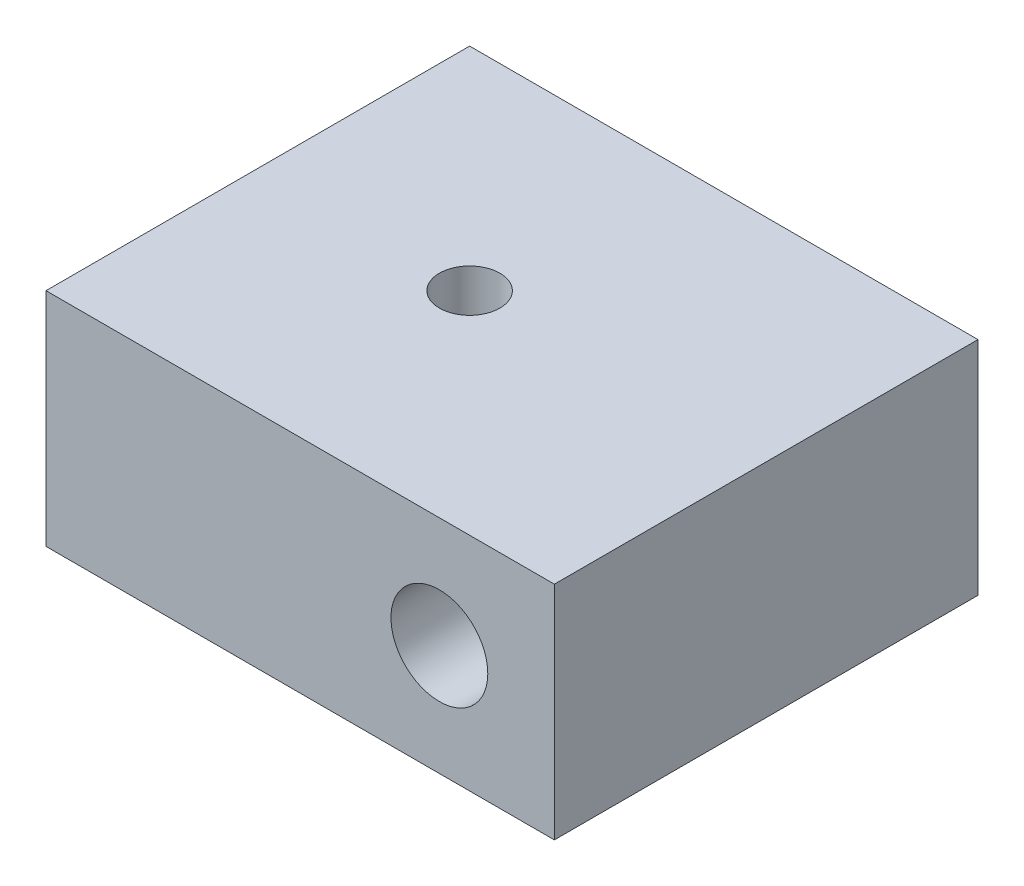
from build123d import *

# Parameters (mm, degrees)
SKETCH1_W           = 42
SKETCH1_H           = 35
SKETCH1_R           = 2.5
BOSS_EXTRUDE1_DEPTH = 18.3
SKETCH2_R           = 4
CUT_EXTRUDE1_DEPTH  = 58.653187249


with BuildPart() as part:
    # Sketch1 → Boss-Extrude1 (new body)
    with BuildSketch(Plane(origin=(0, 0, 0), x_dir=(1, 0, 0), z_dir=(0, 1, 0))):
        with Locations((21, 17.5)):
            Rectangle(SKETCH1_W, SKETCH1_H)
        with Locations((17.5, 17.5)):
            Circle(SKETCH1_R, mode=Mode.SUBTRACT)
    extrude(amount=BOSS_EXTRUDE1_DEPTH)

    # Sketch2 → Cut-Extrude1 (cut, through all)
    with BuildSketch(Plane.XY):
        with Locations((32.5, 9.15)):
            Circle(SKETCH2_R)
    extrude(amount=-CUT_EXTRUDE1_DEPTH, mode=Mode.SUBTRACT)


solid = part.part
